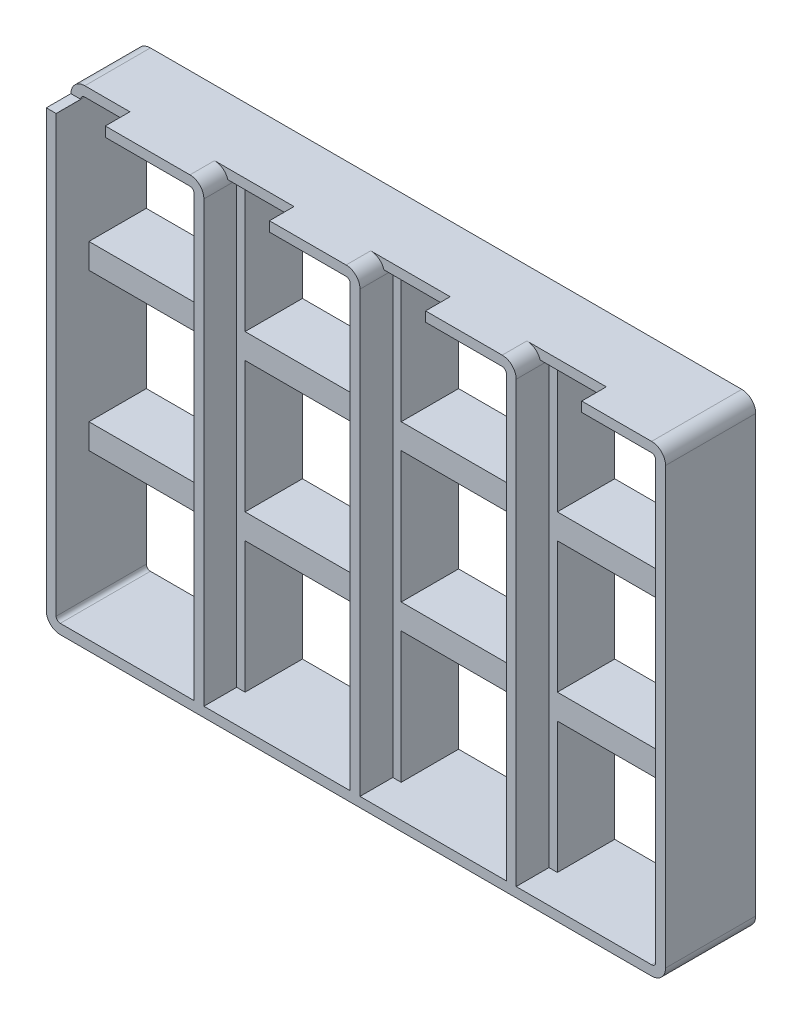
from build123d import *

# Parameters (mm, degrees)
SKICA1_W                 = 16
SKICA1_H                 = 16
P_IDAT_VYSUNUT_M1_DEPTH  = 7
SKICA2_W                 = 17.85
SKICA2_H                 = 54.1
P_IDAT_VYSUNUT_M2_DEPTH  = 4
SKICA3_W                 = 7.868538626
SKICA3_H                 = 3.04290642
SKICA3_W_2               = 8
SKICA3_H_2               = 2.219116854
SKICA3_H_3               = 2.772139553
SKICA3_H_4               = 2.562795671
ODEBRAT_VYSUNUT_M1_DEPTH = 3
ZAOBLIT1_R               = 0.5
ZAOBLIT2_R               = 1.7


with BuildPart() as part:
    # Skica1 → Přidat vysunutím1 (new body)
    with BuildSketch(Plane.XY):
        with BuildLine():
            Line((-7.5, 47.3), (64.65, 47.3))
            ThreePointArc((64.65, 47.3), (65.852081528, 46.802081528), (66.35, 45.6))
            Line((66.35, 45.6), (66.35, -7.5))
            ThreePointArc((66.35, -7.5), (65.852081528, -8.702081528), (64.65, -9.2))
            Line((64.65, -9.2), (-7.5, -9.2))
            ThreePointArc((-7.5, -9.2), (-8.702081528, -8.702081528), (-9.2, -7.5))
            Line((-9.2, -7.5), (-9.2, 45.6))
            ThreePointArc((-9.2, 45.6), (-8.702081528, 46.802081528), (-7.5, 47.3))
        make_face()
        with Locations((19.05, 0)):
            Rectangle(SKICA1_W, SKICA1_H, mode=Mode.SUBTRACT)
        with BuildLine():
            Line((-8, 8), (8, 8))
            Line((8, 8), (8, -8))
            Line((8, -8), (-7.5, -8))
            ThreePointArc((-7.5, -8), (-7.853553391, -7.853553391), (-8, -7.5))
            Line((-8, -7.5), (-8, 8))
        make_face(mode=Mode.SUBTRACT)
        with Locations((38.1, 0)):
            Rectangle(SKICA1_W, SKICA1_H, mode=Mode.SUBTRACT)
        with BuildLine():
            Line((49.15, 8), (49.15, -8))
            Line((49.15, -8), (64.65, -8))
            ThreePointArc((64.65, -8), (65.003553391, -7.853553391), (65.15, -7.5))
            Line((65.15, -7.5), (65.15, 8))
            Line((65.15, 8), (49.15, 8))
        make_face(mode=Mode.SUBTRACT)
        with Locations((19.05, 19.05)):
            Rectangle(SKICA1_W, SKICA1_H, mode=Mode.SUBTRACT)
        with Locations((38.1, 19.05)):
            Rectangle(SKICA1_W, SKICA1_H, mode=Mode.SUBTRACT)
        with Locations((57.15, 19.05)):
            Rectangle(SKICA1_W, SKICA1_H, mode=Mode.SUBTRACT)
        with Locations((19.05, 38.1)):
            Rectangle(SKICA1_W, SKICA1_H, mode=Mode.SUBTRACT)
        with Locations((38.1, 38.1)):
            Rectangle(SKICA1_W, SKICA1_H, mode=Mode.SUBTRACT)
        with BuildLine():
            Line((49.15, 46.1), (49.15, 30.1))
            Line((49.15, 30.1), (65.15, 30.1))
            Line((65.15, 30.1), (65.15, 45.6))
            ThreePointArc((65.15, 45.6), (65.003553391, 45.953553391), (64.65, 46.1))
            Line((64.65, 46.1), (49.15, 46.1))
        make_face(mode=Mode.SUBTRACT)
        with Locations((0, 19.05)):
            Rectangle(SKICA1_W, SKICA1_H, mode=Mode.SUBTRACT)
        with BuildLine():
            Line((-8, 45.6), (-8, 30.1))
            Line((-8, 30.1), (8, 30.1))
            Line((8, 30.1), (8, 46.1))
            Line((8, 46.1), (-7.5, 46.1))
            ThreePointArc((-7.5, 46.1), (-7.853553391, 45.953553391), (-8, 45.6))
        make_face(mode=Mode.SUBTRACT)
    extrude(amount=P_IDAT_VYSUNUT_M1_DEPTH)

    # Skica2 → Přidat vysunutím2 (add)
    with BuildSketch(Plane.XY.offset(7)):
        with BuildLine():
            Line((-7.5, -9.2), (64.65, -9.2))
            ThreePointArc((64.65, -9.2), (65.852081528, -8.702081528), (66.35, -7.5))
            Line((66.35, -7.5), (66.35, 45.6))
            ThreePointArc((66.35, 45.6), (65.852081528, 46.802081528), (64.65, 47.3))
            Line((64.65, 47.3), (-7.5, 47.3))
            ThreePointArc((-7.5, 47.3), (-8.702081528, 46.802081528), (-9.2, 45.6))
            Line((-9.2, 45.6), (-9.2, -7.5))
            ThreePointArc((-9.2, -7.5), (-8.702081528, -8.702081528), (-7.5, -9.2))
        make_face()
        with BuildLine():
            Line((64.65, 46.1), (48.125, 46.1))
            Line((48.125, 46.1), (48.125, -8))
            Line((48.125, -8), (64.65, -8))
            ThreePointArc((64.65, -8), (65.003553391, -7.853553391), (65.15, -7.5))
            Line((65.15, -7.5), (65.15, 45.6))
            ThreePointArc((65.15, 45.6), (65.003553391, 45.953553391), (64.65, 46.1))
        make_face(mode=Mode.SUBTRACT)
        with BuildLine():
            Line((-8, 45.6), (-8, -7.5))
            ThreePointArc((-8, -7.5), (-7.853553391, -7.853553391), (-7.5, -8))
            Line((-7.5, -8), (8.825, -8))
            Line((8.825, -8), (8.825, 46.1))
            Line((8.825, 46.1), (-7.5, 46.1))
            ThreePointArc((-7.5, 46.1), (-7.853553391, 45.953553391), (-8, 45.6))
        make_face(mode=Mode.SUBTRACT)
        with Locations((18.95, 19.05)):
            Rectangle(SKICA2_W, SKICA2_H, mode=Mode.SUBTRACT)
        with Locations((38, 19.05)):
            Rectangle(SKICA2_W, SKICA2_H, mode=Mode.SUBTRACT)
    extrude(amount=P_IDAT_VYSUNUT_M2_DEPTH)

    # Skica3 → Odebrat vysunutím1 (cut)
    with BuildSketch(Plane.XY.offset(11)):
        with Locations((-5.934269313, 47.141342461)):
            Rectangle(SKICA3_W, SKICA3_H)
        with Locations((14.025, 47.209558427)):
            Rectangle(SKICA3_W_2, SKICA3_H_2)
        with Locations((33.075, 47.486069777)):
            Rectangle(SKICA3_W_2, SKICA3_H_3)
        with Locations((52.125, 47.381397836)):
            Rectangle(SKICA3_W_2, SKICA3_H_4)
    extrude(amount=-ODEBRAT_VYSUNUT_M1_DEPTH, mode=Mode.SUBTRACT)

    # Zaoblit1
    zaoblit1_edges = [part.edges().sort_by_distance(p)[0] for p in [
        (8.825, 46.1, 9),
        (27.875, 46.1, 9),
        (46.925, 46.1, 9),
    ]]
    fillet(zaoblit1_edges, radius=ZAOBLIT1_R)

    # Zaoblit2
    # the kernel refuses this fillet: 1.7 mm, written as the material it takes off along each edge
    with BuildSketch(Plane(origin=(48.125, 47.3, 3.75), x_dir=(-1, 0, 0), z_dir=(0, 0, 1))) as zaoblit2_piece_1_section:
        with BuildLine():
            CenterArc((ZAOBLIT2_R, ZAOBLIT2_R), ZAOBLIT2_R, 180, 90)
            Line((0, ZAOBLIT2_R), (0, 0))
            Line((0, 0), (ZAOBLIT2_R, 0))
        make_face()
    zaoblit2_piece_1 = extrude(amount=11.5, mode=Mode.PRIVATE)
    zaoblit2_piece_1 = split(zaoblit2_piece_1, bisect_by=Plane(origin=(48.125338214, 45.903004102, 8), z_dir=(0, 0, -1)), keep=Keep.TOP, mode=Mode.PRIVATE)
    zaoblit2_piece_1 = split(zaoblit2_piece_1, bisect_by=Plane(origin=(48.125338214, 46.1, 7.5), z_dir=(0, -1, 0)), keep=Keep.TOP, mode=Mode.PRIVATE)
    zaoblit2_piece_1 = split(zaoblit2_piece_1, bisect_by=Plane(origin=(48.125338214, 45.903004102, 7), z_dir=(0, 0, 1)), keep=Keep.TOP, mode=Mode.PRIVATE)
    add(zaoblit2_piece_1, mode=Mode.SUBTRACT)
    with BuildSketch(Plane(origin=(48.125, 47.3, 8), x_dir=(-1, 0, 0), z_dir=(0, 0, 1))) as zaoblit2_piece_2_section:
        with BuildLine():
            CenterArc((ZAOBLIT2_R, ZAOBLIT2_R), ZAOBLIT2_R, 180, 90)
            Line((0, ZAOBLIT2_R), (0, 0))
            Line((0, 0), (ZAOBLIT2_R, 0))
        make_face()
    zaoblit2_piece_2 = extrude(amount=7.25, mode=Mode.PRIVATE)
    zaoblit2_piece_2 = split(zaoblit2_piece_2, bisect_by=Plane(origin=(47.724111446, 46.1, 11.625), z_dir=(0, 1, 0)), keep=Keep.TOP, mode=Mode.PRIVATE)
    add(zaoblit2_piece_2, mode=Mode.SUBTRACT)
    with BuildSketch(Plane(origin=(48.125, 47.3, 8), x_dir=(-1, 0, 0), z_dir=(0, 0, 1))) as zaoblit2_piece_3_section:
        with BuildLine():
            CenterArc((ZAOBLIT2_R, ZAOBLIT2_R), ZAOBLIT2_R, 180, 90)
            Line((0, ZAOBLIT2_R), (0, 0))
            Line((0, 0), (ZAOBLIT2_R, 0))
        make_face()
    zaoblit2_piece_3 = extrude(amount=7.25, mode=Mode.PRIVATE)
    zaoblit2_piece_3 = split(zaoblit2_piece_3, bisect_by=Plane(origin=(48.125338214, 46.1, 11.625), z_dir=(0, -1, 0)), keep=Keep.TOP, mode=Mode.PRIVATE)
    add(zaoblit2_piece_3, mode=Mode.SUBTRACT)
    with BuildSketch(Plane(origin=(29.075, 47.3, 3.75), x_dir=(-1, 0, 0), z_dir=(0, 0, 1))) as zaoblit2_piece_4_section:
        with BuildLine():
            CenterArc((ZAOBLIT2_R, ZAOBLIT2_R), ZAOBLIT2_R, 180, 90)
            Line((0, ZAOBLIT2_R), (0, 0))
            Line((0, 0), (ZAOBLIT2_R, 0))
        make_face()
    zaoblit2_piece_4 = extrude(amount=11.5, mode=Mode.PRIVATE)
    zaoblit2_piece_4 = split(zaoblit2_piece_4, bisect_by=Plane(origin=(29.075338214, 46.1, 7.5), z_dir=(0, -1, 0)), keep=Keep.TOP, mode=Mode.PRIVATE)
    zaoblit2_piece_4 = split(zaoblit2_piece_4, bisect_by=Plane(origin=(29.075338214, 45.903004102, 8), z_dir=(0, 0, -1)), keep=Keep.TOP, mode=Mode.PRIVATE)
    zaoblit2_piece_4 = split(zaoblit2_piece_4, bisect_by=Plane(origin=(29.075338214, 45.903004102, 7), z_dir=(0, 0, 1)), keep=Keep.TOP, mode=Mode.PRIVATE)
    add(zaoblit2_piece_4, mode=Mode.SUBTRACT)
    with BuildSketch(Plane(origin=(29.075, 47.3, 8), x_dir=(-1, 0, 0), z_dir=(0, 0, 1))) as zaoblit2_piece_5_section:
        with BuildLine():
            CenterArc((ZAOBLIT2_R, ZAOBLIT2_R), ZAOBLIT2_R, 180, 90)
            Line((0, ZAOBLIT2_R), (0, 0))
            Line((0, 0), (ZAOBLIT2_R, 0))
        make_face()
    zaoblit2_piece_5 = extrude(amount=7.25, mode=Mode.PRIVATE)
    zaoblit2_piece_5 = split(zaoblit2_piece_5, bisect_by=Plane(origin=(28.674111446, 46.1, 11.625), z_dir=(0, 1, 0)), keep=Keep.TOP, mode=Mode.PRIVATE)
    add(zaoblit2_piece_5, mode=Mode.SUBTRACT)
    with BuildSketch(Plane(origin=(29.075, 47.3, 8), x_dir=(-1, 0, 0), z_dir=(0, 0, 1))) as zaoblit2_piece_6_section:
        with BuildLine():
            CenterArc((ZAOBLIT2_R, ZAOBLIT2_R), ZAOBLIT2_R, 180, 90)
            Line((0, ZAOBLIT2_R), (0, 0))
            Line((0, 0), (ZAOBLIT2_R, 0))
        make_face()
    zaoblit2_piece_6 = extrude(amount=7.25, mode=Mode.PRIVATE)
    zaoblit2_piece_6 = split(zaoblit2_piece_6, bisect_by=Plane(origin=(29.075338214, 46.1, 11.625), z_dir=(0, -1, 0)), keep=Keep.TOP, mode=Mode.PRIVATE)
    add(zaoblit2_piece_6, mode=Mode.SUBTRACT)
    with BuildSketch(Plane(origin=(10.025, 47.3, 3.75), x_dir=(-1, 0, 0), z_dir=(0, 0, 1))) as zaoblit2_piece_7_section:
        with BuildLine():
            CenterArc((ZAOBLIT2_R, ZAOBLIT2_R), ZAOBLIT2_R, 180, 90)
            Line((0, ZAOBLIT2_R), (0, 0))
            Line((0, 0), (ZAOBLIT2_R, 0))
        make_face()
    zaoblit2_piece_7 = extrude(amount=11.5, mode=Mode.PRIVATE)
    zaoblit2_piece_7 = split(zaoblit2_piece_7, bisect_by=Plane(origin=(10.025338214, 46.1, 7.5), z_dir=(0, -1, 0)), keep=Keep.TOP, mode=Mode.PRIVATE)
    zaoblit2_piece_7 = split(zaoblit2_piece_7, bisect_by=Plane(origin=(10.025338214, 45.903004102, 8), z_dir=(0, 0, -1)), keep=Keep.TOP, mode=Mode.PRIVATE)
    zaoblit2_piece_7 = split(zaoblit2_piece_7, bisect_by=Plane(origin=(10.025338214, 45.903004102, 7), z_dir=(0, 0, 1)), keep=Keep.TOP, mode=Mode.PRIVATE)
    add(zaoblit2_piece_7, mode=Mode.SUBTRACT)
    with BuildSketch(Plane(origin=(10.025, 47.3, 8), x_dir=(-1, 0, 0), z_dir=(0, 0, 1))) as zaoblit2_piece_8_section:
        with BuildLine():
            CenterArc((ZAOBLIT2_R, ZAOBLIT2_R), ZAOBLIT2_R, 180, 90)
            Line((0, ZAOBLIT2_R), (0, 0))
            Line((0, 0), (ZAOBLIT2_R, 0))
        make_face()
    zaoblit2_piece_8 = extrude(amount=7.25, mode=Mode.PRIVATE)
    zaoblit2_piece_8 = split(zaoblit2_piece_8, bisect_by=Plane(origin=(9.624111446, 46.1, 11.625), z_dir=(0, 1, 0)), keep=Keep.TOP, mode=Mode.PRIVATE)
    add(zaoblit2_piece_8, mode=Mode.SUBTRACT)
    with BuildSketch(Plane(origin=(10.025, 47.3, 8), x_dir=(-1, 0, 0), z_dir=(0, 0, 1))) as zaoblit2_piece_9_section:
        with BuildLine():
            CenterArc((ZAOBLIT2_R, ZAOBLIT2_R), ZAOBLIT2_R, 180, 90)
            Line((0, ZAOBLIT2_R), (0, 0))
            Line((0, 0), (ZAOBLIT2_R, 0))
        make_face()
    zaoblit2_piece_9 = extrude(amount=7.25, mode=Mode.PRIVATE)
    zaoblit2_piece_9 = split(zaoblit2_piece_9, bisect_by=Plane(origin=(10.025338214, 46.1, 11.625), z_dir=(0, -1, 0)), keep=Keep.TOP, mode=Mode.PRIVATE)
    add(zaoblit2_piece_9, mode=Mode.SUBTRACT)


solid = part.part
